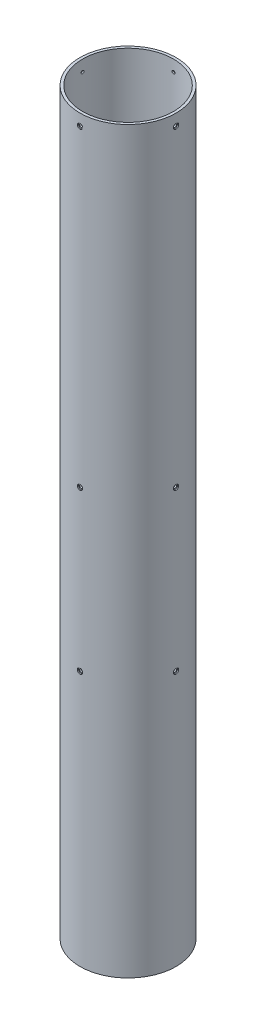
from build123d import *

# Parameters (mm, degrees)
SKETCH1_R            = 53.721
SKETCH1_R_2          = 50.8
TUBE_EXTRUSION_DEPTH = 825.5
BULKHEAD_HOLES_REACH = 836.194
SKETCH3_R            = 1.6383
HOLE_PATTERN_COUNT   = 4
SKETCH4_R            = 2.9083
SKETCH4_R_2          = 1.6383
CUT_EXTRUDE1_DEPTH   = 1.27
CIRPATTERN1_COUNT    = 4


with BuildPart() as part:
    # Sketch1 → Tube Extrusion (new body)
    with BuildSketch(Plane(origin=(0, 0, 0), x_dir=(1, 0, 0), z_dir=(0, 1, 0))):
        Circle(SKETCH1_R)
        Circle(SKETCH1_R_2, mode=Mode.SUBTRACT)
    extrude(amount=TUBE_EXTRUSION_DEPTH)

    # Sketch3 → Bulkhead Holes (cut, up to next)
    with BuildSketch(Plane.XY.offset(53.721), mode=Mode.PRIVATE) as bulkhead_holes_sk1:
        with Locations((0, 463.55)):
            Circle(SKETCH3_R)
    bulkhead_holes_tool1 = extrude(bulkhead_holes_sk1.sketch, amount=-BULKHEAD_HOLES_REACH, mode=Mode.PRIVATE) & part.part
    # Sketch3 → Bulkhead Holes (cut, up to next)
    with BuildSketch(Plane.XY.offset(53.721), mode=Mode.PRIVATE) as bulkhead_holes_sk2:
        with Locations((0, 285.75)):
            Circle(SKETCH3_R)
    bulkhead_holes_tool2 = extrude(bulkhead_holes_sk2.sketch, amount=-BULKHEAD_HOLES_REACH, mode=Mode.PRIVATE) & part.part
    # Sketch3 → Bulkhead Holes (cut, up to next)
    with BuildSketch(Plane.XY.offset(53.721), mode=Mode.PRIVATE) as bulkhead_holes_sk3:
        with Locations((0, 812.8)):
            Circle(SKETCH3_R)
    bulkhead_holes_tool3 = extrude(bulkhead_holes_sk3.sketch, amount=-BULKHEAD_HOLES_REACH, mode=Mode.PRIVATE) & part.part
    bulkhead_holes_1 = bulkhead_holes_tool1.solids().sort_by_distance((0, 463.55, 53.721))[0]
    add(bulkhead_holes_1, mode=Mode.SUBTRACT)
    bulkhead_holes_2 = bulkhead_holes_tool2.solids().sort_by_distance((0, 285.75, 53.721))[0]
    add(bulkhead_holes_2, mode=Mode.SUBTRACT)
    bulkhead_holes_3 = bulkhead_holes_tool3.solids().sort_by_distance((0, 812.8, 53.721))[0]
    add(bulkhead_holes_3, mode=Mode.SUBTRACT)
    bulkhead_holes = bulkhead_holes_1 + bulkhead_holes_2 + bulkhead_holes_3  # Bulkhead Holes as one shape, for the pattern or mirror that repeats it

    # Hole Pattern: Bulkhead Holes ×4 about axis
    hole_pattern_axis = Axis((0, 825.5, 0), (0, -1, 0))
    for i in range(1, HOLE_PATTERN_COUNT):
        add(bulkhead_holes.rotate(hole_pattern_axis, i * 360 / HOLE_PATTERN_COUNT), mode=Mode.SUBTRACT)

    # Sketch4 → Cut-Extrude1 (cut)
    # profile 1 of 3: a face of its own
    with BuildSketch(Plane.XY.offset(53.721)):
        with Locations((0, 812.8)):
            Circle(SKETCH4_R)
        with Locations((0, 812.8)):
            Circle(SKETCH4_R_2, mode=Mode.SUBTRACT)
    # profile 2 of 3: a face of its own
    with BuildSketch(Plane.XY.offset(53.721)):
        with Locations((0, 463.55)):
            Circle(SKETCH4_R)
        with Locations((0, 463.55)):
            Circle(SKETCH4_R_2, mode=Mode.SUBTRACT)
    # profile 3 of 3: a face of its own
    with BuildSketch(Plane.XY.offset(53.721)):
        with Locations((0, 285.75)):
            Circle(SKETCH4_R)
        with Locations((0, 285.75)):
            Circle(SKETCH4_R_2, mode=Mode.SUBTRACT)
    cut_extrude1 = extrude(amount=-CUT_EXTRUDE1_DEPTH, mode=Mode.SUBTRACT)

    # CirPattern1: Cut-Extrude1 ×4 about axis
    cirpattern1_axis = Axis((0, 825.5, 0), (0, -1, 0))
    for i in range(1, CIRPATTERN1_COUNT):
        add(cut_extrude1.rotate(cirpattern1_axis, i * 360 / CIRPATTERN1_COUNT), mode=Mode.SUBTRACT)


solid = part.part
